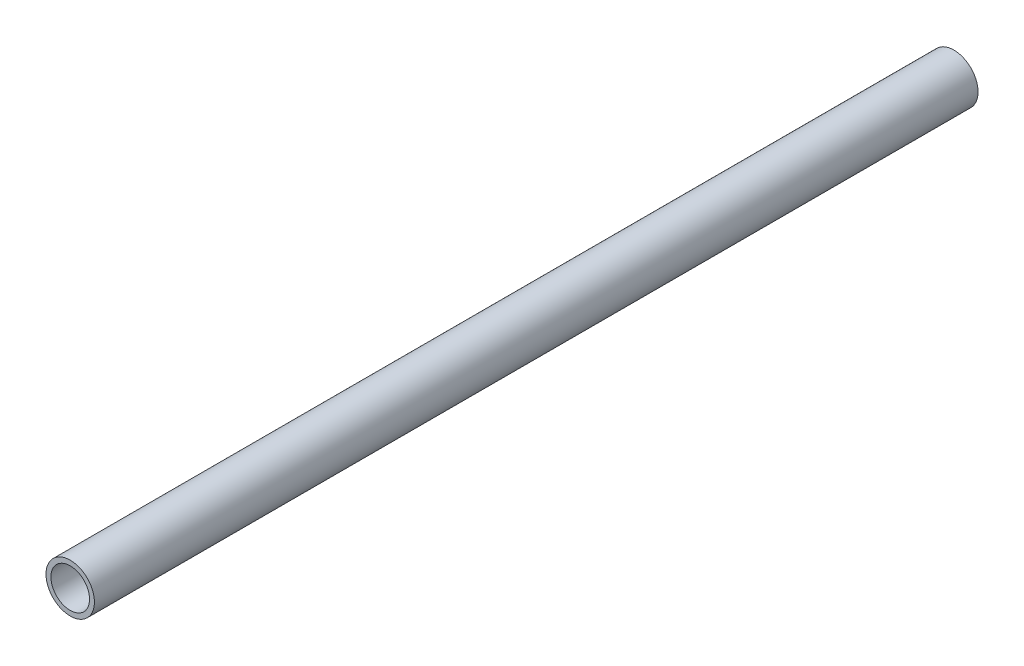
from build123d import *

# Parameters (mm, degrees)
SKETCH1_R           = 16.7005
SKETCH1_R_2         = 13.3223
BOSS_EXTRUDE1_DEPTH = 609.6


with BuildPart() as part:
    # Sketch1 → Boss-Extrude1 (new body)
    with BuildSketch(Plane.XY):
        Circle(SKETCH1_R)
        Circle(SKETCH1_R_2, mode=Mode.SUBTRACT)
    extrude(amount=BOSS_EXTRUDE1_DEPTH)


solid = part.part
